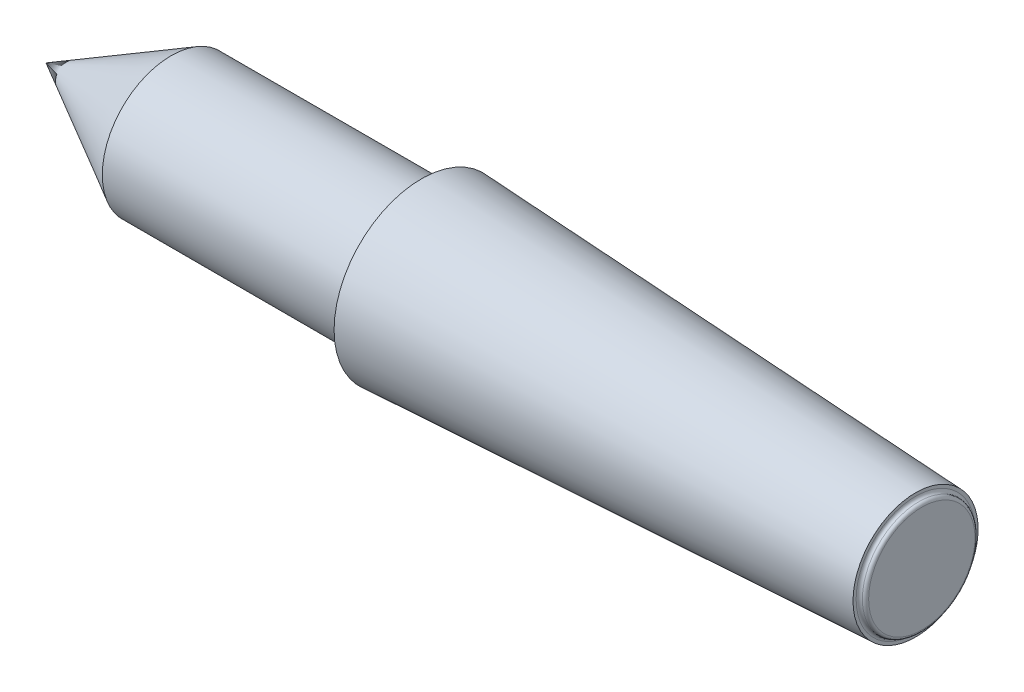
from build123d import *

# Parameters (mm, degrees)
FILLET_1_R = 0.5


with BuildPart() as part:
    # 草图1 → 旋转1 (revolve)
    with BuildSketch(Plane(origin=(0, 0, 0), x_dir=(1, 0, 0), z_dir=(0, 1, 0)), mode=Mode.PRIVATE) as revolve_1_sk:
        Polygon((-140, 0), (-120, 11), (-80, 11), (-80, 13.95), (-1, 10), (-1, 9), (0, 9), (0, 0), align=None)
    revolve(revolve_1_sk.sketch.rotate(Axis((-857.450785528, 0, 0), (1, 0, 0)), 180), axis=Axis((-857.450785528, 0, 0), (1, 0, 0)))

    # 圆角1
    fillet_1_edges = [part.edges().sort_by_distance(p)[0] for p in [
        (0, 0, -9),
        (-1, 0, -9),
        (-80, 0, -11),
    ]]
    fillet(fillet_1_edges, radius=FILLET_1_R - 0.0001)  # a hair under: the kernel refuses the full size


solid = part.part
